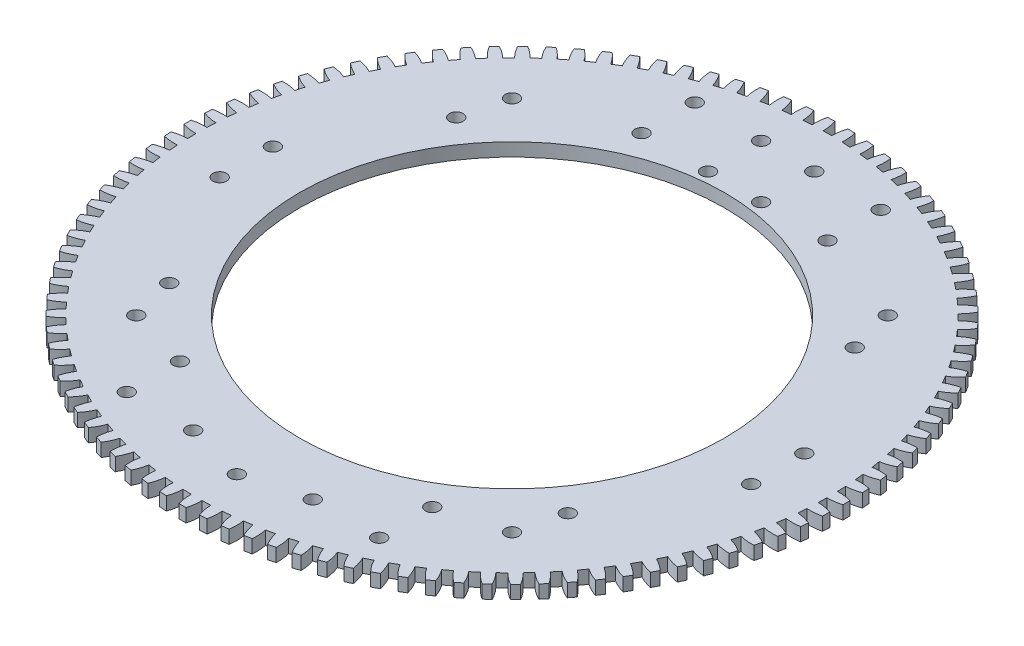
from build123d import *

# Parameters (mm, degrees)
SKETCH1_R           = 152.4
SKETCH1_R_2         = 101.6
BOSS_EXTRUDE1_DEPTH = 6.35
SKETCH8_R           = 157.272387589
SKETCH8_R_2         = 150.325074
BOSS_EXTRUDE2_DEPTH = 6.35
SKETCH9_R           = 157.499685
BOSS_EXTRUDE3_DEPTH = 6.35
CUT_EXTRUDE5_DEPTH  = 6.35
CIRPATTERN1_COUNT   = 103
SKETCH4_R           = 3.2639
CUT_EXTRUDE1_DEPTH  = 223.827589014
SKETCH5_R           = 3.2639
CUT_EXTRUDE2_DEPTH  = 22.225
SKETCH6_R           = 3.2639
CUT_EXTRUDE3_DEPTH  = 6.35
SKETCH7_R           = 3.2639
CUT_EXTRUDE4_DEPTH  = 6.35
SKETCH12_R          = 101.6
CUT_EXTRUDE6_DEPTH  = 223.827589014
SKETCH13_R          = 3.2639
CUT_EXTRUDE7_DEPTH  = 25.4
SKETCH14_R          = 3.2639
CUT_EXTRUDE8_DEPTH  = 6.35


with BuildPart() as part:
    # Sketch1 → Boss-Extrude1 (new body)
    with BuildSketch(Plane(origin=(0, 0, 0), x_dir=(1, 0, 0), z_dir=(0, 1, 0))):
        Circle(SKETCH1_R)
        Circle(SKETCH1_R_2, mode=Mode.SUBTRACT)
    extrude(amount=BOSS_EXTRUDE1_DEPTH)

    # Sketch8 → Boss-Extrude2 (add)
    with BuildSketch(Plane(origin=(0, 6.35, 0), x_dir=(1, 0, 0), z_dir=(0, 1, 0))):
        Circle(SKETCH8_R)
        Circle(SKETCH8_R_2, mode=Mode.SUBTRACT)
    extrude(amount=-BOSS_EXTRUDE2_DEPTH)

    # Sketch9 → Boss-Extrude3 (add)
    with BuildSketch(Plane(origin=(0, 6.35, 0), x_dir=(1, 0, 0), z_dir=(0, 1, 0))):
        Circle(SKETCH9_R)
    extrude(amount=-BOSS_EXTRUDE3_DEPTH)

    # Sketch11 → Cut-Extrude5 (cut)
    with BuildSketch(Plane(origin=(0, 6.35, 0), x_dir=(1, 0, 0), z_dir=(0, 1, 0))):
        with BuildLine():
            ThreePointArc((-3.450937816, 158.462112738), (-2.388916489, 154.663388466), (-2.021744582, 150.73612731))
            ThreePointArc((-2.021744582, 150.73612731), (0, 150.749685), (2.021744582, 150.73612731))
            ThreePointArc((2.021744582, 150.73612731), (2.388916489, 154.663388466), (3.450937816, 158.462112738))
            ThreePointArc((3.450937816, 158.462112738), (0, 158.499685), (-3.450937816, 158.462112738))
        make_face()
    cut_extrude5 = extrude(amount=-CUT_EXTRUDE5_DEPTH, mode=Mode.SUBTRACT)

    # CirPattern1: Cut-Extrude5 ×103 about axis
    cirpattern1_axis = Axis((0, 0, 0), (0, 1, 0))
    for i in range(1, CIRPATTERN1_COUNT):
        add(cut_extrude5.rotate(cirpattern1_axis, i * 360 / CIRPATTERN1_COUNT), mode=Mode.SUBTRACT)

    # Sketch4 → Cut-Extrude1 (cut, through all)
    with BuildSketch(Plane(origin=(0, 6.35, 0), x_dir=(1, 0, 0), z_dir=(0, 1, 0))):
        with Locations((-12.7, 106.3625)):
            Circle(SKETCH4_R)
        with Locations((-44.45, 106.3625)):
            Circle(SKETCH4_R)
        with Locations((-12.7, 131.7625)):
            Circle(SKETCH4_R)
        with Locations((-44.45, 131.7625)):
            Circle(SKETCH4_R)
        with Locations((12.7, 131.7625)):
            Circle(SKETCH4_R)
        with Locations((44.45, 131.7625)):
            Circle(SKETCH4_R)
        with Locations((44.45, 106.3625)):
            Circle(SKETCH4_R)
        with Locations((12.7, 106.3625)):
            Circle(SKETCH4_R)
    extrude(amount=-CUT_EXTRUDE1_DEPTH, mode=Mode.SUBTRACT)

    # Sketch5 → Cut-Extrude2 (cut)
    with BuildSketch(Plane(origin=(0, 6.35, 0), x_dir=(1, 0, 0), z_dir=(0, 1, 0))):
        with Locations((-60.325, -123.825)):
            Circle(SKETCH5_R)
        with Locations((-60.325, -98.425)):
            Circle(SKETCH5_R)
        with Locations((-28.575, -123.825)):
            Circle(SKETCH5_R)
        with Locations((28.575, -123.825)):
            Circle(SKETCH5_R)
        with Locations((60.325, -123.825)):
            Circle(SKETCH5_R)
        with Locations((60.325, -98.425)):
            Circle(SKETCH5_R)
    extrude(amount=-CUT_EXTRUDE2_DEPTH, mode=Mode.SUBTRACT)

    # Sketch6 → Cut-Extrude3 (cut)
    with BuildSketch(Plane(origin=(0, 6.35, 0), x_dir=(1, 0, 0), z_dir=(0, 1, 0))):
        with Locations((89.802561211, -89.802561211)):
            Circle(SKETCH6_R)
        with Locations((-89.802561211, -89.802561211)):
            Circle(SKETCH6_R)
        with Locations((-89.802561211, 89.802561211)):
            Circle(SKETCH6_R)
        with Locations((89.802561211, 89.802561211)):
            Circle(SKETCH6_R)
    extrude(amount=-CUT_EXTRUDE3_DEPTH, mode=Mode.SUBTRACT)

    # Sketch7 → Cut-Extrude4 (cut)
    with BuildSketch(Plane(origin=(0, 6.35, 0), x_dir=(1, 0, 0), z_dir=(0, 1, 0))):
        with Locations((-127, 12.7)):
            Circle(SKETCH7_R)
        with Locations((-127, -12.7)):
            Circle(SKETCH7_R)
        with Locations((127, -12.7)):
            Circle(SKETCH7_R)
        with Locations((127, 12.7)):
            Circle(SKETCH7_R)
    extrude(amount=-CUT_EXTRUDE4_DEPTH, mode=Mode.SUBTRACT)

    # Sketch12 → Cut-Extrude6 (cut, through all)
    with BuildSketch(Plane(origin=(0, 6.35, 0), x_dir=(1, 0, 0), z_dir=(0, 1, 0))):
        Circle(SKETCH12_R)
    extrude(amount=-CUT_EXTRUDE6_DEPTH, mode=Mode.SUBTRACT)

    # Sketch13 → Cut-Extrude7 (cut)
    with BuildSketch(Plane(origin=(0, 6.35, 0), x_dir=(1, 0, 0), z_dir=(0, 1, 0))):
        with Locations((95.25, -68.58)):
            Circle(SKETCH13_R)
        with Locations((-95.25, -68.58)):
            Circle(SKETCH13_R)
        with Locations((-95.25, 68.58)):
            Circle(SKETCH13_R)
        with Locations((95.25, 68.58)):
            Circle(SKETCH13_R)
    extrude(amount=-CUT_EXTRUDE7_DEPTH, mode=Mode.SUBTRACT)

    # Sketch14 → Cut-Extrude8 (cut)
    with BuildSketch(Plane.XZ):
        with Locations((0, 131.5339)):
            Circle(SKETCH14_R)
    extrude(amount=-CUT_EXTRUDE8_DEPTH, mode=Mode.SUBTRACT)


solid = part.part
